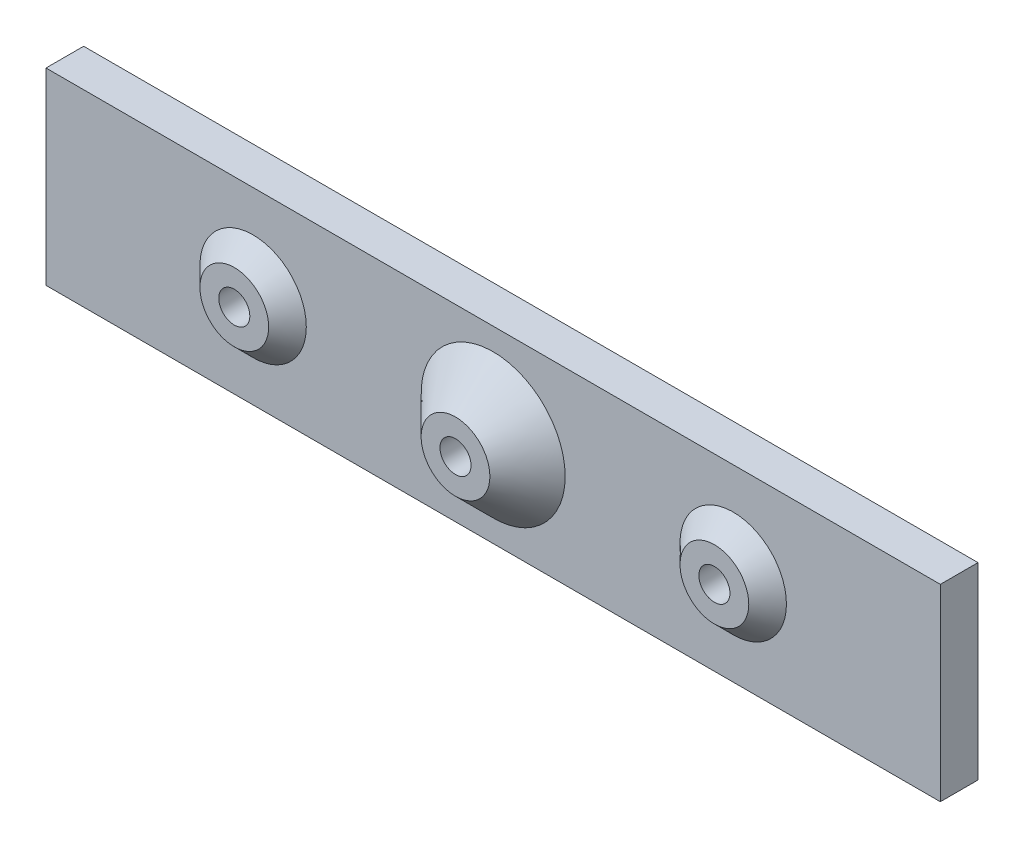
from build123d import *

# Parameters (mm, degrees)
SKETCH1_W           = 95
SKETCH1_H           = 20
SKETCH1_R           = 1.65
BOSS_EXTRUDE1_DEPTH = 4
SKETCH2_R           = 5.65
SKETCH2_R_2         = 1.65
EXTRUDE_THIN1_DEPTH = 2
CHAMFER1_SIZE       = 2
SKETCH3_R           = 7.65
SKETCH3_R_2         = 1.65
EXTRUDE_THIN2_DEPTH = 4
CHAMFER2_SIZE       = 4


with BuildPart() as part:
    # Sketch1 → Boss-Extrude1 (new body)
    with BuildSketch(Plane.XY):
        Rectangle(SKETCH1_W, SKETCH1_H)
        Circle(SKETCH1_R, mode=Mode.SUBTRACT)
        with Locations((25.5, 0)):
            Circle(SKETCH1_R, mode=Mode.SUBTRACT)
        with Locations((-25.5, 0)):
            Circle(SKETCH1_R, mode=Mode.SUBTRACT)
    extrude(amount=BOSS_EXTRUDE1_DEPTH)

    # Sketch2 → Extrude-Thin1 (add)
    # profile 1 of 2: a face of its own
    with BuildSketch(Plane.XY.offset(4)):
        with Locations((-25.5, 0)):
            Circle(SKETCH2_R)
        with Locations((-25.5, 0)):
            Circle(SKETCH2_R_2, mode=Mode.SUBTRACT)
    # profile 2 of 2: a face of its own
    with BuildSketch(Plane.XY.offset(4)):
        with Locations((25.5, 0)):
            Circle(SKETCH2_R)
        with Locations((25.5, 0)):
            Circle(SKETCH2_R_2, mode=Mode.SUBTRACT)
    extrude(amount=EXTRUDE_THIN1_DEPTH)

    # Chamfer1
    chamfer1_edges = [part.edges().sort_by_distance(p)[0] for p in [
        (-31.15, 0, 6),
        (19.85, 0, 6),
    ]]
    chamfer(chamfer1_edges, length=CHAMFER1_SIZE - 0.0001)  # a hair under: the kernel refuses the full size

    # Sketch3 → Extrude-Thin2 (add)
    with BuildSketch(Plane.XY.offset(4)):
        Circle(SKETCH3_R)
        Circle(SKETCH3_R_2, mode=Mode.SUBTRACT)
    extrude(amount=EXTRUDE_THIN2_DEPTH)

    # Chamfer2
    chamfer2_edges = [part.edges().sort_by_distance(p)[0] for p in [
        (-7.65, 0, 8),
    ]]
    chamfer(chamfer2_edges, length=CHAMFER2_SIZE - 0.0001)  # a hair under: the kernel refuses the full size


solid = part.part
